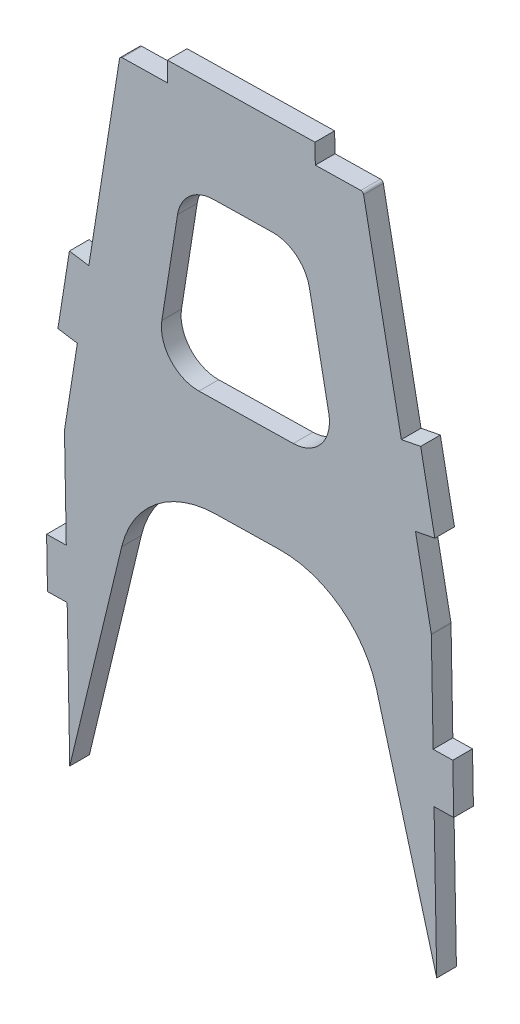
from build123d import *

# Parameters (mm, degrees)
BOSS_EXTRUDE2_DEPTH = 5.08
FILLET2_R           = 9.525
FILLET3_R           = 25.4


with BuildPart() as part:
    # Sketch5 → Boss-Extrude2 (new body)
    with BuildSketch(Plane(origin=(0, 0, -50.8), x_dir=(-1, 0, 0), z_dir=(0, 0, -1))):
        with BuildLine():
            Line((-52.13468263, -75.221320794), (-56.212080888, -96.107453162))
            ThreePointArc((-56.212080888, -96.107453162), (-56.221630566, -96.170999694), (-56.22560546, -96.235136722))
            Line((-56.22560546, -96.235136722), (-56.689450482, -121.630901089))
            Line((-56.689450482, -121.630901089), (-61.768603356, -121.538132084))
            Line((-61.768603356, -121.538132084), (-62.000525867, -134.236014268))
            Line((-62.000525867, -134.236014268), (-56.921372993, -134.328783272))
            Line((-56.921372993, -134.328783272), (-57.614804697, -172.294541905))
            Line((-57.614804697, -172.294541905), (-36.871429662, -96.460703597))
            Line((-36.871429662, -96.460703597), (19.102978067, -97.483057167))
            Line((19.102978067, -97.483057167), (37.094867375, -172.294541905))
            Line((37.094867375, -172.294541905), (37.756714673, -136.058046429))
            Line((37.756714673, -136.058046429), (42.835867547, -136.150815433))
            Line((42.835867547, -136.150815433), (43.067790058, -123.45293325))
            Line((43.067790058, -123.45293325), (37.988637184, -123.360164245))
            Line((37.988637184, -123.360164245), (38.452482206, -97.964399878))
            ThreePointArc((38.452482206, -97.964399878), (38.450852064, -97.900160477), (38.443629293, -97.836307602))
            Line((38.443629293, -97.836307602), (35.131652361, -76.815210802))
            Line((35.131652361, -76.815210802), (40.149750658, -76.024584796))
            Line((40.149750658, -76.024584796), (37.184903136, -57.206716182))
            Line((37.184903136, -57.206716182), (32.166804839, -57.997342188))
            Line((32.166804839, -57.997342188), (24.260544781, -7.816359217))
            ThreePointArc((24.260544781, -7.816359217), (24.016623377, -7.375472208), (23.546372034, -7.194522821))
            Line((23.546372034, -7.194522821), (11.812618795, -6.980209798))
            Line((11.812618795, -6.980209798), (11.905387799, -1.901056925))
            Line((11.905387799, -1.901056925), (-26.188258752, -1.205289392))
            Line((-26.188258752, -1.205289392), (-26.281027756, -6.284442265))
            Line((-26.281027756, -6.284442265), (-38.014780995, -6.070129243))
            ThreePointArc((-38.014780995, -6.070129243), (-38.491326447, -6.233785707), (-38.751185095, -6.665471344))
            Line((-38.751185095, -6.665471344), (-48.484637848, -56.524270944))
            Line((-48.484637848, -56.524270944), (-53.470517808, -55.550925668))
            Line((-53.470517808, -55.550925668), (-57.12056259, -74.247975518))
            Line((-57.12056259, -74.247975518), (-52.13468263, -75.221320794))
        make_face()
        Polygon((8.034989272, -27.234601748), (15.088864635, -72.005504408), (-31.929626187, -71.146727622), (-23.245550268, -26.663273304), align=None, mode=Mode.SUBTRACT)
    extrude(amount=BOSS_EXTRUDE2_DEPTH)

    # Fillet2
    fillet2_edges = [part.edges().sort_by_distance(p)[0] for p in [
        (23.245550268, -26.663273304, -53.34),
        (-8.034989272, -27.234601748, -53.34),
        (31.929626187, -71.146727622, -53.34),
        (-15.088864635, -72.005504408, -53.34),
    ]]
    fillet(fillet2_edges, radius=FILLET2_R)

    # Fillet3
    fillet3_edges = [part.edges().sort_by_distance(p)[0] for p in [
        (-19.102978067, -97.483057167, -53.34),
        (36.871429662, -96.460703597, -53.34),
    ]]
    fillet(fillet3_edges, radius=FILLET3_R)


solid = part.part
